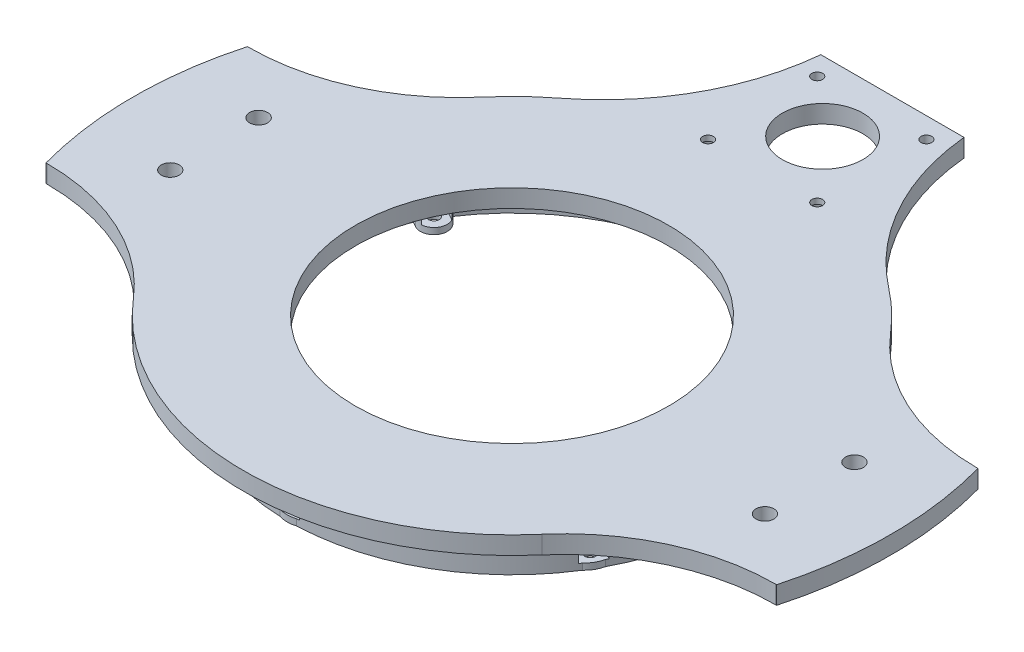
from build123d import *

# Parameters (mm, degrees)
SKETCH1_R            = 76.2
SKETCH1_R_2          = 44.45
BOSS_EXTRUDE1_DEPTH  = 5.08
BOSS_EXTRUDE12_DEPTH = 5.08
SKETCH7_R            = 44.45
BOSS_EXTRUDE13_DEPTH = 5.08
SKETCH8_R            = 2.54
CUT_EXTRUDE1_DEPTH   = 132.886411546
SKETCH11_R           = 2.55773741
SKETCH11_R_2         = 2.443934978
SKETCH11_R_3         = 2.44571327
SKETCH11_R_4         = 2.563372012
CUT_EXTRUDE2_DEPTH   = 132.886411546
SKETCH12_R           = 63.5
SKETCH12_R_2         = 62.23
BOSS_EXTRUDE15_DEPTH = 13.716
SKETCH13_R           = 66.04
SKETCH13_R_2         = 63.5
BOSS_EXTRUDE16_DEPTH = 3.81
SKETCH14_W           = 40.64
SKETCH14_H           = 43.18
SKETCH14_R           = 11.43
BOSS_EXTRUDE17_DEPTH = 5.08
CUT_EXTRUDE3_START   = -5.08
SKETCH15_R           = 11.43
SKETCH15_R_2         = 1.524
CUT_EXTRUDE3_DEPTH   = 5.08
BOSS_EXTRUDE19_DEPTH = 13.716
SKETCH18_R           = 1.524
BOSS_EXTRUDE20_DEPTH = 13.716
SKETCH19_W           = 6.35
SKETCH19_H           = 2.794
CUT_EXTRUDE4_DEPTH   = 15.24
CIRPATTERN1_COUNT    = 6
SKETCH21_R           = 3.048
CUT_EXTRUDE6_DEPTH   = 3.556
FILLET2_R            = 68.58


with BuildPart() as part:
    # Sketch1 → Boss-Extrude1 (new body)
    with BuildSketch(Plane(origin=(0, 0, 0), x_dir=(1, 0, 0), z_dir=(0, 1, 0))):
        with Locations(Location((0, 0, 0), (0, 0, 270))):
            Circle(SKETCH1_R)
        with Locations(Location((0, 0, 0), (0, 0, 270))):
            Circle(SKETCH1_R_2, mode=Mode.SUBTRACT)
    extrude(amount=BOSS_EXTRUDE1_DEPTH)

    # Sketch6 → Boss-Extrude12 (add, through all)
    with BuildSketch(Plane(origin=(0, 5.08, 0), x_dir=(1, 0, 0), z_dir=(0, 1, 0))):
        with BuildLine():
            Line((-103.65929059, 28.575), (-70.63929059, 28.575))
            ThreePointArc((-70.63929059, 28.575), (-76.2, 0), (-70.63929059, -28.575))
            Line((-70.63929059, -28.575), (-103.65929059, -28.575))
            ThreePointArc((-103.65929059, -28.575), (-107.525713904, 0), (-103.65929059, 28.575))
        make_face()
        with BuildLine():
            Line((103.65929059, -28.575), (70.63929059, -28.575))
            ThreePointArc((70.63929059, -28.575), (76.2, 0), (70.63929059, 28.575))
            Line((70.63929059, 28.575), (103.65929059, 28.575))
            ThreePointArc((103.65929059, 28.575), (107.525713904, 0), (103.65929059, -28.575))
        make_face()
    extrude(amount=-BOSS_EXTRUDE12_DEPTH)

    # Sketch7 → Boss-Extrude13 (add, through all)
    with BuildSketch(Plane(origin=(0, 5.08, 0), x_dir=(1, 0, 0), z_dir=(0, 1, 0))):
        with BuildLine():
            Line((-103.65929059, 28.575), (-103.321739605, 28.575))
            ThreePointArc((-103.321739605, 28.575), (-78.334957702, 34.056542817), (-57.937424078, 49.494392523))
            ThreePointArc((-57.937424078, 49.494392523), (0, 76.2), (57.937424078, 49.494392523))
            ThreePointArc((57.937424078, 49.494392523), (78.334957702, 34.056542817), (103.321739605, 28.575))
            Line((103.321739605, 28.575), (103.65929059, 28.575))
            Line((103.65929059, 28.575), (103.65929059, -28.575))
            Line((103.65929059, -28.575), (103.321739605, -28.575))
            ThreePointArc((103.321739605, -28.575), (78.334957702, -34.056542817), (57.937424078, -49.494392523))
            ThreePointArc((57.937424078, -49.494392523), (0, -76.2), (-57.937424078, -49.494392523))
            ThreePointArc((-57.937424078, -49.494392523), (-78.334957702, -34.056542817), (-103.321739605, -28.575))
            Line((-103.321739605, -28.575), (-103.65929059, -28.575))
            Line((-103.65929059, -28.575), (-103.65929059, 28.575))
        make_face()
        with Locations(Location((0, 0, 0), (0, 0, 270))):
            Circle(SKETCH7_R, mode=Mode.SUBTRACT)
    extrude(amount=-BOSS_EXTRUDE13_DEPTH)

    # Sketch8 → Cut-Extrude1 (cut, through all)
    with BuildSketch(Plane(origin=(0, 5.08, 0), x_dir=(1, 0, 0), z_dir=(0, 1, 0))):
        with Locations(Location((-84.60929059, 12.7, 0), (0, 0, 270))):
            Circle(SKETCH8_R)
        with Locations(Location((-84.271739605, -12.7, 0), (0, 0, 270))):
            Circle(SKETCH8_R)
        with Locations(Location((84.60929059, 12.573, 0), (0, 0, 270))):
            Circle(SKETCH8_R)
        with Locations(Location((84.60929059, -12.827, 0), (0, 0, 270))):
            Circle(SKETCH8_R)
    extrude(amount=-CUT_EXTRUDE1_DEPTH, mode=Mode.SUBTRACT)

    # Sketch11 → Cut-Extrude2 (cut, through all)
    with BuildSketch(Plane.XZ):
        with Locations(Location((84.60929059, -12.573, 0), (0, 0, 270))):
            Circle(SKETCH11_R)
        with Locations((84.60929059, 12.827)):
            Circle(SKETCH11_R_2)
        with Locations((-84.271739605, 12.7)):
            Circle(SKETCH11_R_3)
        with Locations(Location((-84.60929059, -12.7, 0), (0, 0, 270))):
            Circle(SKETCH11_R_4)
    extrude(amount=-CUT_EXTRUDE2_DEPTH, mode=Mode.SUBTRACT)

    # Sketch12 → Boss-Extrude15 (add)
    with BuildSketch(Plane.XZ):
        with Locations(Location((0, 0, 0), (0, 0, 90))):
            Circle(SKETCH12_R)
        with Locations(Location((0, 0, 0), (0, 0, 270))):
            Circle(SKETCH12_R_2, mode=Mode.SUBTRACT)
    extrude(amount=BOSS_EXTRUDE15_DEPTH)

    # Sketch13 → Boss-Extrude16 (add)
    with BuildSketch(Plane.XZ):
        with Locations(Location((0, 0, 0), (0, 0, 90))):
            Circle(SKETCH13_R)
        with Locations(Location((0, 0, 0), (0, 0, 270))):
            Circle(SKETCH13_R_2, mode=Mode.SUBTRACT)
    extrude(amount=BOSS_EXTRUDE16_DEPTH)

    # Sketch14 → Boss-Extrude17 (add)
    with BuildSketch(Plane.XZ):
        with Locations((0, -86.36)):
            Rectangle(SKETCH14_W, SKETCH14_H)
        with Locations(Location((0, -88.138, 0), (0, 0, 270))):
            Circle(SKETCH14_R, mode=Mode.SUBTRACT)
    extrude(amount=-BOSS_EXTRUDE17_DEPTH)

    # Sketch15 → Cut-Extrude3 (cut)
    with BuildSketch(Plane(origin=(0, 5.08, 0), x_dir=(1, 0, 0), z_dir=(0, 1, 0)).offset(CUT_EXTRUDE3_START)):
        with Locations(Location((0, 88.138, 0), (0, 0, 90))):
            Circle(SKETCH15_R)
        with Locations(Location((-15.494, 102.108, 0), (0, 0, 270))):
            Circle(SKETCH15_R_2)
        with Locations(Location((15.494, 102.108, 0), (0, 0, 270))):
            Circle(SKETCH15_R_2)
        with Locations(Location((15.494, 71.12, 0), (0, 0, 270))):
            Circle(SKETCH15_R_2)
        with Locations(Location((-15.494, 71.12, 0), (0, 0, 270))):
            Circle(SKETCH15_R_2)
    extrude(amount=CUT_EXTRUDE3_DEPTH, mode=Mode.SUBTRACT)

    # Sketch17 → Boss-Extrude19 (add, through all)
    with BuildSketch(Plane.XZ):
        with BuildLine():
            ThreePointArc((53.768378144, -33.781822209), (54.99261314, -31.75), (56.140105291, -29.673870289))
            ThreePointArc((56.140105291, -29.673870289), (55.268247185, -31.90913739), (53.768378144, -33.781822209))
        make_face()
        with BuildLine():
            ThreePointArc((2.371727147, -63.455692498), (0, -63.81827478), (-2.371727147, -63.455692498))
            ThreePointArc((-2.371727147, -63.455692498), (0, -63.5), (2.371727147, -63.455692498))
        make_face()
        with BuildLine():
            ThreePointArc((-53.768378144, -33.781822209), (-55.268247185, -31.90913739), (-56.140105291, -29.673870289))
            ThreePointArc((-56.140105291, -29.673870289), (-54.99261314, -31.75), (-53.768378144, -33.781822209))
        make_face()
        with BuildLine():
            ThreePointArc((-56.140105291, 29.673870289), (-55.268247185, 31.90913739), (-53.768378144, 33.781822209))
            ThreePointArc((-53.768378144, 33.781822209), (-54.99261314, 31.75), (-56.140105291, 29.673870289))
        make_face()
        with BuildLine():
            ThreePointArc((-2.371727147, 63.455692498), (0, 63.81827478), (2.371727147, 63.455692498))
            ThreePointArc((2.371727147, 63.455692498), (0, 63.5), (-2.371727147, 63.455692498))
        make_face()
        with BuildLine():
            ThreePointArc((53.768378144, 33.781822209), (55.268247185, 31.90913739), (56.140105291, 29.673870289))
            ThreePointArc((56.140105291, 29.673870289), (54.99261314, 31.75), (53.768378144, 33.781822209))
        make_face()
    extrude(amount=BOSS_EXTRUDE19_DEPTH)

    # Sketch18 → Boss-Extrude20 (add, through all)
    # profile 1 of 6: a face of its own
    with BuildSketch(Plane.XZ):
        with BuildLine():
            Line((-3.81, -60.579), (-3.81, -62.113257844))
            ThreePointArc((-3.81, -62.113257844), (0, -62.23), (3.81, -62.113257844))
            Line((3.81, -62.113257844), (3.81, -60.579))
            ThreePointArc((3.81, -60.579), (0, -56.769), (-3.81, -60.579))
        make_face()
        with Locations(Location((0, -60.579, 0), (0, 0, 270))):
            Circle(SKETCH18_R, mode=Mode.SUBTRACT)
    # profile 2 of 6: a face of its own
    with BuildSketch(Plane.XZ):
        with BuildLine():
            Line((-54.367952936, -26.989943212), (-55.696659205, -27.757072134))
            ThreePointArc((-55.696659205, -27.757072134), (-53.892760878, -31.115), (-51.886659205, -34.35618571))
            Line((-51.886659205, -34.35618571), (-50.557952936, -33.589056788))
            ThreePointArc((-50.557952936, -33.589056788), (-49.163396147, -28.3845), (-54.367952936, -26.989943212))
        make_face()
        with Locations(Location((-52.462952936, -30.2895, 0), (0, 0, 270))):
            Circle(SKETCH18_R, mode=Mode.SUBTRACT)
    # profile 3 of 6: a face of its own
    with BuildSketch(Plane.XZ):
        with BuildLine():
            Line((-50.557952936, 33.589056788), (-51.886659205, 34.35618571))
            ThreePointArc((-51.886659205, 34.35618571), (-53.892760878, 31.115), (-55.696659205, 27.757072134))
            Line((-55.696659205, 27.757072134), (-54.367952936, 26.989943212))
            ThreePointArc((-54.367952936, 26.989943212), (-49.163396147, 28.3845), (-50.557952936, 33.589056788))
        make_face()
        with Locations(Location((-52.462952936, 30.2895, 0), (0, 0, 270))):
            Circle(SKETCH18_R, mode=Mode.SUBTRACT)
    # profile 4 of 6: a face of its own
    with BuildSketch(Plane.XZ):
        with BuildLine():
            Line((3.81, 60.579), (3.81, 62.113257844))
            ThreePointArc((3.81, 62.113257844), (0, 62.23), (-3.81, 62.113257844))
            Line((-3.81, 62.113257844), (-3.81, 60.579))
            ThreePointArc((-3.81, 60.579), (0, 56.769), (3.81, 60.579))
        make_face()
        with Locations(Location((0, 60.579, 0), (0, 0, 270))):
            Circle(SKETCH18_R, mode=Mode.SUBTRACT)
    # profile 5 of 6: a face of its own
    with BuildSketch(Plane.XZ):
        with BuildLine():
            Line((54.367952936, 26.989943212), (55.696659205, 27.757072134))
            ThreePointArc((55.696659205, 27.757072134), (53.892760878, 31.115), (51.886659205, 34.35618571))
            Line((51.886659205, 34.35618571), (50.557952936, 33.589056788))
            ThreePointArc((50.557952936, 33.589056788), (49.163396147, 28.3845), (54.367952936, 26.989943212))
        make_face()
        with Locations(Location((52.462952936, 30.2895, 0), (0, 0, 270))):
            Circle(SKETCH18_R, mode=Mode.SUBTRACT)
    # profile 6 of 6: a face of its own
    with BuildSketch(Plane.XZ):
        with BuildLine():
            Line((50.557952936, -33.589056788), (51.886659205, -34.35618571))
            ThreePointArc((51.886659205, -34.35618571), (53.892760878, -31.115), (55.696659205, -27.757072134))
            Line((55.696659205, -27.757072134), (54.367952936, -26.989943212))
            ThreePointArc((54.367952936, -26.989943212), (49.163396147, -28.3845), (50.557952936, -33.589056788))
        make_face()
        with Locations(Location((52.462952936, -30.2895, 0), (0, 0, 270))):
            Circle(SKETCH18_R, mode=Mode.SUBTRACT)
    extrude(amount=BOSS_EXTRUDE20_DEPTH)

    # Sketch19 → Cut-Extrude4 (cut, symmetric)
    with BuildSketch(Plane.XY.offset(-62.113257844)):
        with Locations((0, -10.541)):
            Rectangle(SKETCH19_W, SKETCH19_H)
    cut_extrude4 = extrude(amount=CUT_EXTRUDE4_DEPTH, both=True, mode=Mode.SUBTRACT)

    # CirPattern1: Cut-Extrude4 ×6 about axis
    cirpattern1_axis = Axis((0, 0, 0), (0, 1, 0))
    for i in range(1, CIRPATTERN1_COUNT):
        add(cut_extrude4.rotate(cirpattern1_axis, i * 360 / CIRPATTERN1_COUNT), mode=Mode.SUBTRACT)

    # Sketch21 → Cut-Extrude6 (cut)
    with BuildSketch(Plane.XZ):
        with Locations(Location((15.494, -71.12, 0), (0, 0, 270))):
            Circle(SKETCH21_R)
        with Locations(Location((-15.494, -71.12, 0), (0, 0, 270))):
            Circle(SKETCH21_R)
    extrude(amount=-CUT_EXTRUDE6_DEPTH, mode=Mode.SUBTRACT)

    # Fillet2
    # the kernel refuses this fillet: 68.58 mm, written as the material it adds along each edge
    with BuildSketch(Plane(origin=(20.32, 0, -73.440708058), x_dir=(0.8941931213145367, 0, 0.4476814289132022), z_dir=(0, 1, 0))) as fillet2_piece_1:
        with BuildLine():
            CenterArc((42.653307006, 67.290356345), FILLET2_R, 212.089221398, 46.781764691)
            Line((-15.449169128, 30.857971476), (-16.61121865, 30.129323779))
            ThreePointArc((-16.61121865, 30.129323779), (-8.951059849, 14.81494589), (-1.226475285, -0.614039848))
            Line((-1.226475285, -0.614039848), (0.264744664, -1.345807127))
            ThreePointArc((0.264744664, -1.345807127), (14.708036899, 0.061337395), (29.151329133, -1.345807127))
            Line((29.151329133, -1.345807127), (29.416073797, 0))
        make_face()
    extrude(amount=5.08)
    with BuildSketch(Plane(origin=(-20.32, 0, -73.440708058), x_dir=(0, 0, -1), z_dir=(0, 1, 0))) as fillet2_piece_2:
        with BuildLine():
            CenterArc((41.075480346, 68.264936606), FILLET2_R, 217.724037777, 46.781764691)
            Line((-13.16902995, 26.303650845), (-14.253920156, 25.46442513))
            ThreePointArc((-14.253920156, 25.46442513), (-6.529667499, 13.179285035), (-1.321932745, -0.36576))
            Line((-1.321932745, -0.36576), (0, -1.3716))
            ThreePointArc((0, -1.3716), (17.254645971, -1.3716), (34.377968174, -1.365298732))
            Line((34.377968174, -1.365298732), (34.509291942, 0))
        make_face()
    extrude(amount=5.08)


solid = part.part
